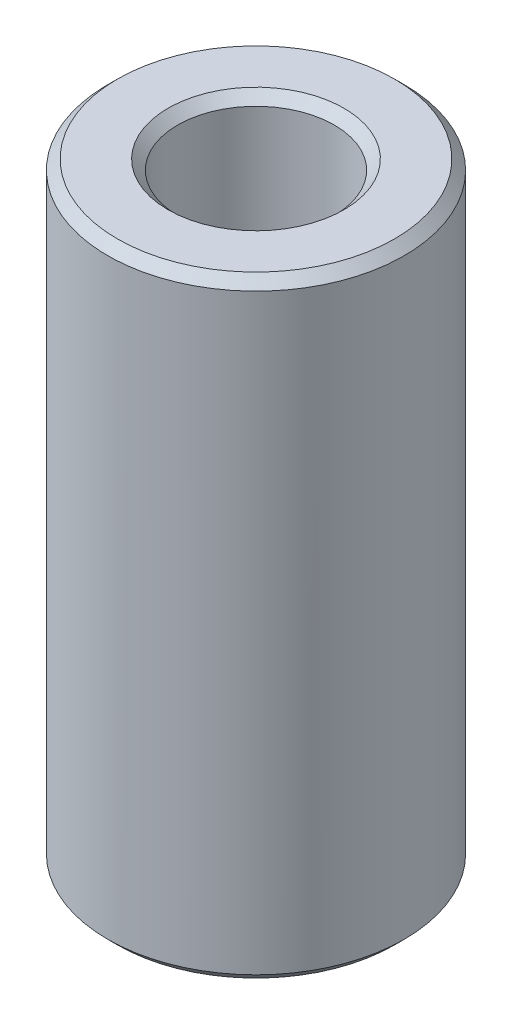
from build123d import *

# Parameters (mm, degrees)
SKETCH1_R           = 60
BOSS_EXTRUDE1_DEPTH = 247.5191738
SKETCH2_R           = 31.692431194
CUT_EXTRUDE1_DEPTH  = 262.659590688
CHAMFER1_SIZE       = 3.921160838


with BuildPart() as part:
    # Sketch1 → Boss-Extrude1 (new body)
    with BuildSketch(Plane(origin=(0, 0, 0), x_dir=(1, 0, 0), z_dir=(0, 1, 0))):
        Circle(SKETCH1_R)
    extrude(amount=BOSS_EXTRUDE1_DEPTH)

    # Sketch2 → Cut-Extrude1 (cut, through all)
    with BuildSketch(Plane(origin=(0, 0, 0), x_dir=(1, 0, 0), z_dir=(0, 1, 0))):
        Circle(SKETCH2_R)
    extrude(amount=CUT_EXTRUDE1_DEPTH, mode=Mode.SUBTRACT)

    # Chamfer1
    chamfer1_edges = [part.edges().sort_by_distance(p)[0] for p in [
        (-31.692431194, 247.5191738, 0),
        (-31.692431194, 0, 0),
        (-60, 0, 0),
        (-60, 247.5191738, 0),
    ]]
    chamfer(chamfer1_edges, length=CHAMFER1_SIZE)


solid = part.part
